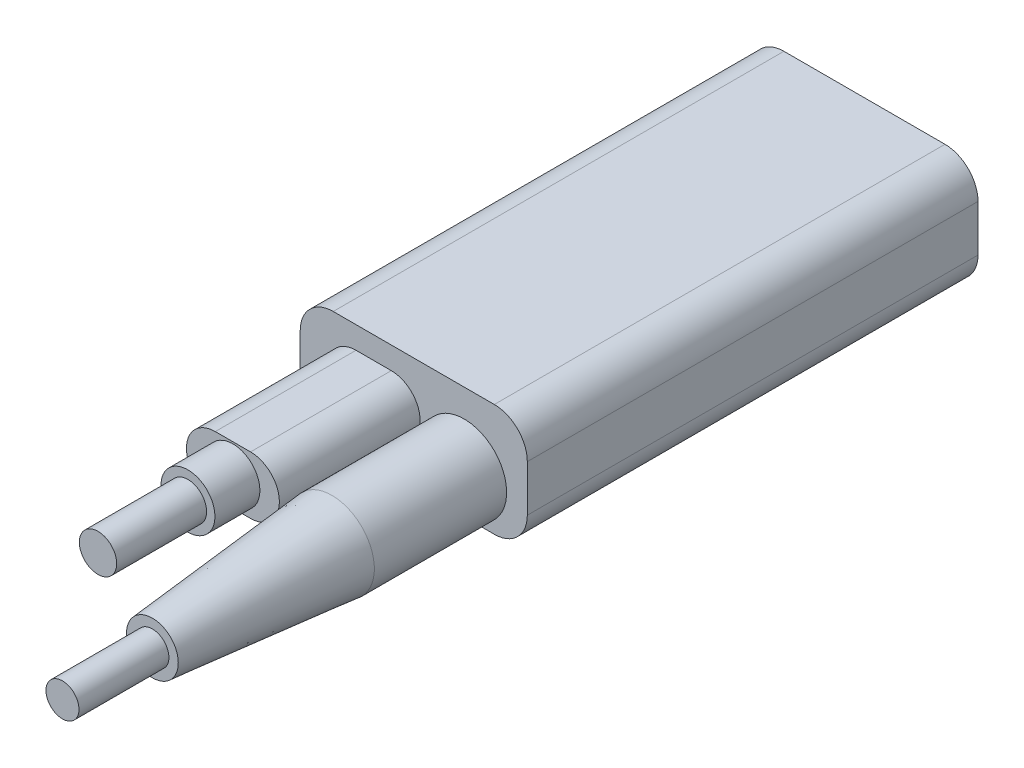
from build123d import *

# Parameters (mm, degrees)
SKETCH1_W           = 25.25
SKETCH1_H           = 12.5
BOSS_EXTRUDE1_DEPTH = 25.055
SKETCH2_W           = 14.5
SKETCH2_H           = 5.7
CUT_EXTRUDE1_DEPTH  = 10
BOSS_EXTRUDE2_DEPTH = 15.65
SKETCH4_R           = 4.715
BOSS_EXTRUDE3_DEPTH = 14.71
SKETCH5_R           = 2.875
SKETCH6_R           = 1.835
BOSS_EXTRUDE4_DEPTH = 10
SKETCH7_R           = 3
BOSS_EXTRUDE5_DEPTH = 5
SKETCH8_R           = 2.075
BOSS_EXTRUDE6_DEPTH = 10
FILLET1_R           = 3.67


with BuildPart() as part:
    # Sketch1 → Boss-Extrude1 (new, symmetric)
    with BuildSketch(Plane.XY):
        Rectangle(SKETCH1_W, SKETCH1_H)
    extrude(amount=BOSS_EXTRUDE1_DEPTH, both=True)

    # Sketch2 → Cut-Extrude1 (cut)
    with BuildSketch(Plane(origin=(0, 0, -25.055), x_dir=(-1, 0, 0), z_dir=(0, 0, -1))):
        with Locations((0, -1.17)):
            Rectangle(SKETCH2_W, SKETCH2_H)
    extrude(amount=-CUT_EXTRUDE1_DEPTH, mode=Mode.SUBTRACT)

    # Sketch3 → Boss-Extrude2 (add)
    with BuildSketch(Plane.XY.offset(25.055)):
        with BuildLine():
            Line((-6.42, 3.78), (-2.5, 3.78))
            ThreePointArc((-2.5, 3.78), (0.705, 0.575), (-2.5, -2.63))
            Line((-2.5, -2.63), (-6.42, -2.63))
            ThreePointArc((-6.42, -2.63), (-9.625, 0.575), (-6.42, 3.78))
        make_face()
    extrude(amount=BOSS_EXTRUDE2_DEPTH)

    # Sketch4 → Boss-Extrude3 (add)
    with BuildSketch(Plane.XY.offset(25.055)):
        with Locations((5.61, -1.535)):
            Circle(SKETCH4_R)
    extrude(amount=BOSS_EXTRUDE3_DEPTH)

    # Sketch5 → section 1 of loft1
    with BuildSketch(Plane.XY.offset(59.725), mode=Mode.PRIVATE) as loft1_s1:
        with Locations((5.61, -1.535)):
            Circle(SKETCH5_R)
    # loft from a face of the part (loft1)
    loft([part.faces().sort_by_distance((5.61, -1.535, 39.765))[0], loft1_s1.sketch])

    # Sketch6 → Boss-Extrude4 (add)
    with BuildSketch(Plane.XY.offset(59.725)):
        with Locations((5.61, -1.535)):
            Circle(SKETCH6_R)
    extrude(amount=BOSS_EXTRUDE4_DEPTH)

    # Sketch7 → Boss-Extrude5 (add)
    with BuildSketch(Plane.XY.offset(40.705)):
        with Locations((-4.46, 0.575)):
            Circle(SKETCH7_R)
    extrude(amount=BOSS_EXTRUDE5_DEPTH)

    # Sketch8 → Boss-Extrude6 (add)
    with BuildSketch(Plane.XY.offset(45.705)):
        with Locations((-4.46, 0.575)):
            Circle(SKETCH8_R)
    extrude(amount=BOSS_EXTRUDE6_DEPTH)

    # Fillet1
    fillet1_edges = [part.edges().sort_by_distance(p)[0] for p in [
        (12.625, -6.25, 0),
        (12.625, 6.25, 0),
        (-12.625, -6.25, 0),
        (-12.625, 6.25, 0),
    ]]
    fillet(fillet1_edges, radius=FILLET1_R)


solid = part.part
